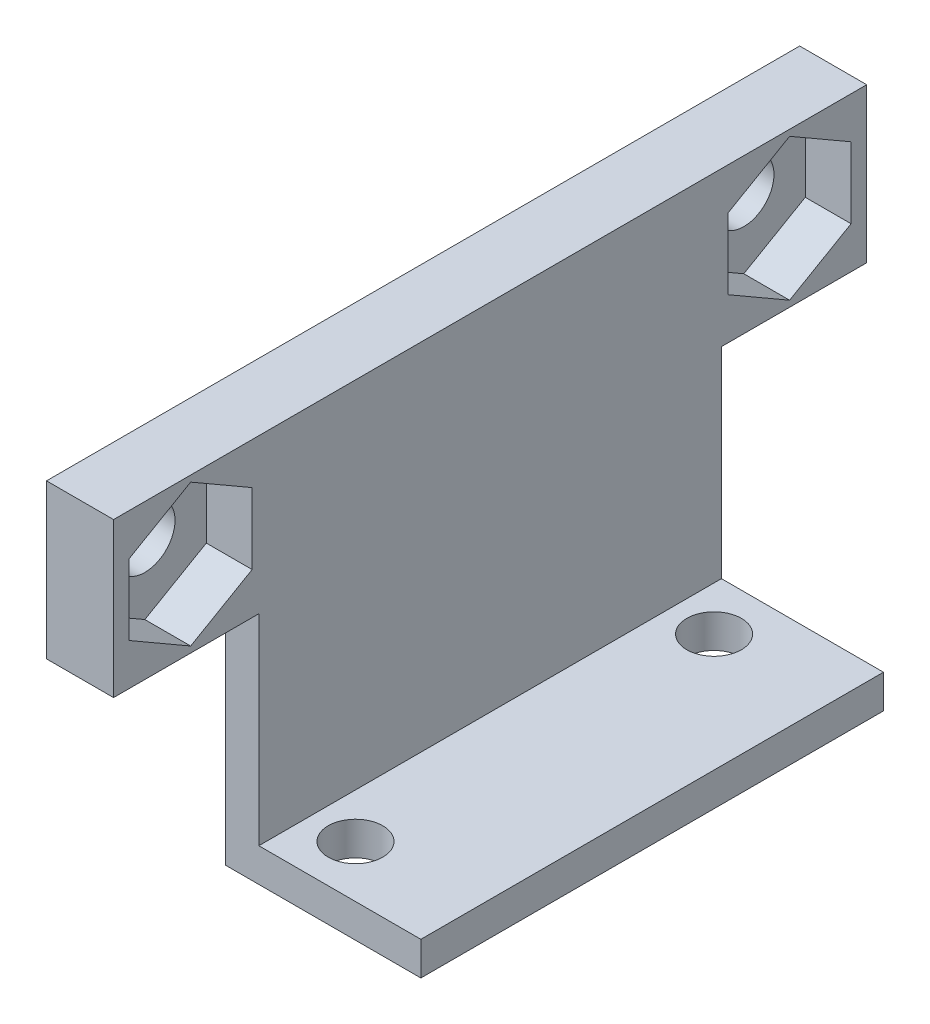
from build123d import *

# Parameters (mm, degrees)
SKETCH2_W               = 17.75
SKETCH2_H               = 20.7
SKETCH2_R               = 1.22
BOSS_EXTRUDE1_DEPTH     = 1.5
SKETCH12_W              = 20.7
SKETCH12_H              = 1.5
CUT_EXTRUDE2_DEPTH      = 10.5
SKETCH5_W               = 20.7
SKETCH5_H               = 8.940198937
BOSS_EXTRUDE3_DEPTH     = 1.5
SKETCH25_W              = 1.5
SKETCH25_H              = 20.7
BOSS_EXTRUDE5_DEPTH     = 4.5
SKETCH26_W              = 33.7
SKETCH26_H              = 6.9
SKETCH26_R              = 1.35
BOSS_EXTRUDE9_DEPTH     = 3
CUT_EXTRUDE3_DEPTH      = 0.55
CUT_EXTRUDE3_DEPTH_BACK = 1.5


with BuildPart() as part:
    # Sketch2 → Boss-Extrude1 (new body)
    with BuildSketch(Plane(origin=(0, 0, 0), x_dir=(1, 0, 0), z_dir=(0, 1, 0))):
        with Locations((8.875, 10.35)):
            Rectangle(SKETCH2_W, SKETCH2_H)
        with Locations((1.996494824, 2.32830664)):
            Circle(SKETCH2_R, mode=Mode.SUBTRACT)
        with Locations((1.982091411, 18.38849058)):
            Circle(SKETCH2_R, mode=Mode.SUBTRACT)
    extrude(amount=BOSS_EXTRUDE1_DEPTH)

    # Sketch12 → Cut-Extrude2 (cut)
    with BuildSketch(Plane(origin=(17.75, 0, 0), x_dir=(0, 0, -1), z_dir=(1, 0, 0))):
        with Locations((10.35, 0.75)):
            Rectangle(SKETCH12_W, SKETCH12_H)
    extrude(amount=-CUT_EXTRUDE2_DEPTH, mode=Mode.SUBTRACT)

    # Sketch5 → Boss-Extrude3 (add)
    with BuildSketch(Plane.ZY):
        with Locations((-10.35, 4.470099468)):
            Rectangle(SKETCH5_W, SKETCH5_H)
    extrude(amount=BOSS_EXTRUDE3_DEPTH)

    # Sketch25 → Boss-Extrude5 (add)
    with BuildSketch(Plane(origin=(0, 8.940198937, 0), x_dir=(1, 0, 0), z_dir=(0, 1, 0))):
        with Locations((-0.75, 10.35)):
            Rectangle(SKETCH25_W, SKETCH25_H)
    extrude(amount=BOSS_EXTRUDE5_DEPTH)

    # Sketch26 → Boss-Extrude9 (add)
    with BuildSketch(Plane(origin=(0, 0, 0), x_dir=(0, 0, -1), z_dir=(1, 0, 0))):
        with Locations((10.35, 13.940198937)):
            Rectangle(SKETCH26_W, SKETCH26_H)
        with Locations((23.75, 13.940198937)):
            Circle(SKETCH26_R, mode=Mode.SUBTRACT)
        with Locations((-3.05, 13.940198937)):
            Circle(SKETCH26_R, mode=Mode.SUBTRACT)
    extrude(amount=-BOSS_EXTRUDE9_DEPTH)

    # Sketch29 → Cut-Extrude3 (cut, two sides: drawn at the far end of the back side and taken through both)
    with BuildSketch(Plane.ZY.offset(1.5).offset(-CUT_EXTRUDE3_DEPTH_BACK)):
        Polygon((-26.5, 12.352485697), (-23.75, 10.764772456), (-21, 12.352485697), (-21, 15.527912177), (-23.75, 17.115625417), (-26.5, 15.527912177), align=None)
        Polygon((0.3, 12.352485697), (3.05, 10.764772456), (5.8, 12.352485697), (5.8, 15.527912177), (3.05, 17.115625417), (0.3, 15.527912177), align=None)
    extrude(amount=CUT_EXTRUDE3_DEPTH + CUT_EXTRUDE3_DEPTH_BACK, mode=Mode.SUBTRACT)


solid = part.part
